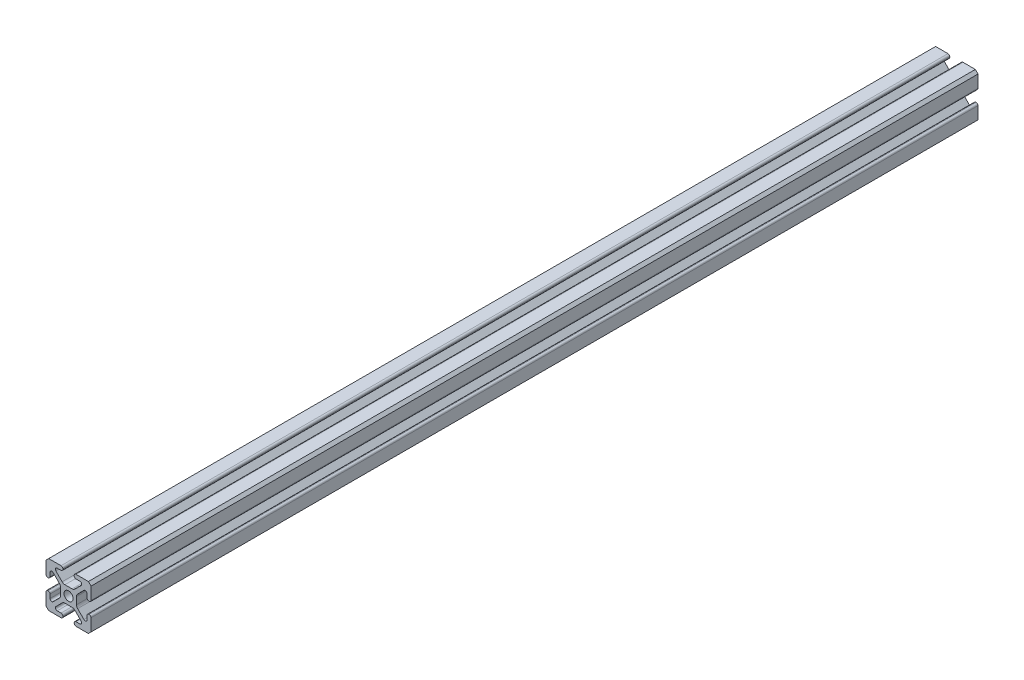
from build123d import *

# Parameters (mm, degrees)
BOSS_EXTRUDE1_DEPTH = 500


with BuildPart() as part:
    # Sketch1 → Boss-Extrude1 (new body)
    with BuildSketch(Plane.XY):
        with BuildLine():
            Line((-11.199951579, -12.7), (-4.222256762, -12.7))
            ThreePointArc((-4.222256762, -12.7), (-3.503836272, -12.40242049), (-3.206256762, -11.684))
            Line((-3.206256762, -11.684), (-3.206256762, -11.440665395))
            ThreePointArc((-3.206256762, -11.440665395), (-3.503836272, -10.722244905), (-4.222256762, -10.424665395))
            Line((-4.222256762, -10.424665395), (-6.40926672, -10.424665395))
            ThreePointArc((-6.40926672, -10.424665395), (-7.347928334, -9.797471742), (-7.127687178, -8.690244874))
            Line((-7.127687178, -8.690244874), (-3.593166694, -5.155724698))
            ThreePointArc((-3.593166694, -5.155724698), (-2.876257435, -4.67670128), (-2.030605322, -4.508490626))
            Line((-2.030605322, -4.508490626), (2.030598864, -4.508490626))
            ThreePointArc((2.030598864, -4.508490626), (2.876251031, -4.676701303), (3.593160319, -5.155724782))
            Line((3.593160319, -5.155724782), (7.127680379, -8.690244912))
            ThreePointArc((7.127680379, -8.690244912), (7.347921489, -9.019859032), (7.425259882, -9.408665395))
            ThreePointArc((7.425259882, -9.408665395), (7.127680372, -10.127085884), (6.409259882, -10.424665395))
            Line((6.409259882, -10.424665395), (4.22225065, -10.424665395))
            ThreePointArc((4.22225065, -10.424665395), (3.50383016, -10.722244905), (3.20625065, -11.440665395))
            Line((3.20625065, -11.440665395), (3.20625065, -11.684))
            ThreePointArc((3.20625065, -11.684), (3.50383016, -12.40242049), (4.22225065, -12.7))
            Line((4.22225065, -12.7), (11.199952422, -12.7))
            Line((11.199952422, -12.7), (12.7, -11.199951732))
            Line((12.7, -11.199951732), (12.7, -4.222256762))
            ThreePointArc((12.7, -4.222256762), (12.40242049, -3.503836272), (11.684, -3.206256762))
            Line((11.684, -3.206256762), (11.440665395, -3.206256762))
            ThreePointArc((11.440665395, -3.206256762), (10.722244905, -3.503836272), (10.424665395, -4.222256762))
            Line((10.424665395, -4.222256762), (10.424665395, -6.40926672))
            ThreePointArc((10.424665395, -6.40926672), (9.797471742, -7.347928334), (8.690244874, -7.127687178))
            Line((8.690244874, -7.127687178), (5.155724698, -3.593166694))
            ThreePointArc((5.155724698, -3.593166694), (4.67670128, -2.876257435), (4.508490626, -2.030605322))
            Line((4.508490626, -2.030605322), (4.508490626, 2.030598864))
            ThreePointArc((4.508490626, 2.030598864), (4.676701303, 2.876251031), (5.155724782, 3.593160319))
            Line((5.155724782, 3.593160319), (8.690244912, 7.127680379))
            ThreePointArc((8.690244912, 7.127680379), (9.019859032, 7.347921489), (9.408665395, 7.425259882))
            ThreePointArc((9.408665395, 7.425259882), (10.127085884, 7.127680372), (10.424665395, 6.409259882))
            Line((10.424665395, 6.409259882), (10.424665395, 4.22225065))
            ThreePointArc((10.424665395, 4.22225065), (10.722244905, 3.50383016), (11.440665395, 3.20625065))
            Line((11.440665395, 3.20625065), (11.684, 3.20625065))
            ThreePointArc((11.684, 3.20625065), (12.40242049, 3.50383016), (12.7, 4.22225065))
            Line((12.7, 4.22225065), (12.7, 11.199954756))
            Line((12.7, 11.199954756), (11.199954423, 12.7))
            Line((11.199954423, 12.7), (4.222256762, 12.7))
            ThreePointArc((4.222256762, 12.7), (3.503836272, 12.40242049), (3.206256762, 11.684))
            Line((3.206256762, 11.684), (3.206256762, 11.440665395))
            ThreePointArc((3.206256762, 11.440665395), (3.503836272, 10.722244905), (4.222256762, 10.424665395))
            Line((4.222256762, 10.424665395), (6.40926672, 10.424665395))
            ThreePointArc((6.40926672, 10.424665395), (7.347928334, 9.797471742), (7.127687178, 8.690244874))
            Line((7.127687178, 8.690244874), (3.593166694, 5.155724698))
            ThreePointArc((3.593166694, 5.155724698), (2.876257435, 4.67670128), (2.030605322, 4.508490626))
            Line((2.030605322, 4.508490626), (-2.030598864, 4.508490626))
            ThreePointArc((-2.030598864, 4.508490626), (-2.876251031, 4.676701303), (-3.593160319, 5.155724782))
            Line((-3.593160319, 5.155724782), (-7.127680379, 8.690244912))
            ThreePointArc((-7.127680379, 8.690244912), (-7.347921489, 9.019859032), (-7.425259882, 9.408665395))
            ThreePointArc((-7.425259882, 9.408665395), (-7.127680372, 10.127085884), (-6.409259882, 10.424665395))
            Line((-6.409259882, 10.424665395), (-4.22225065, 10.424665395))
            ThreePointArc((-4.22225065, 10.424665395), (-3.50383016, 10.722244905), (-3.20625065, 11.440665395))
            Line((-3.20625065, 11.440665395), (-3.20625065, 11.684))
            ThreePointArc((-3.20625065, 11.684), (-3.50383016, 12.40242049), (-4.22225065, 12.7))
            Line((-4.22225065, 12.7), (-11.199951733, 12.7))
            Line((-11.199951733, 12.7), (-12.7, 11.1999514))
            Line((-12.7, 11.1999514), (-12.7, 4.222256762))
            ThreePointArc((-12.7, 4.222256762), (-12.40242049, 3.503836272), (-11.684, 3.206256762))
            Line((-11.684, 3.206256762), (-11.440665395, 3.206256762))
            ThreePointArc((-11.440665395, 3.206256762), (-10.722244905, 3.503836272), (-10.424665395, 4.222256762))
            Line((-10.424665395, 4.222256762), (-10.424665395, 6.40926672))
            ThreePointArc((-10.424665395, 6.40926672), (-9.797471742, 7.347928334), (-8.690244874, 7.127687178))
            Line((-8.690244874, 7.127687178), (-5.155724698, 3.593166694))
            ThreePointArc((-5.155724698, 3.593166694), (-4.67670128, 2.876257435), (-4.508490626, 2.030605322))
            Line((-4.508490626, 2.030605322), (-4.508490626, -2.030598864))
            ThreePointArc((-4.508490626, -2.030598864), (-4.676701303, -2.876251031), (-5.155724782, -3.593160319))
            Line((-5.155724782, -3.593160319), (-8.690244912, -7.127680379))
            ThreePointArc((-8.690244912, -7.127680379), (-9.019859032, -7.347921489), (-9.408665395, -7.425259882))
            ThreePointArc((-9.408665395, -7.425259882), (-10.127085884, -7.127680372), (-10.424665395, -6.409259882))
            Line((-10.424665395, -6.409259882), (-10.424665395, -4.22225065))
            ThreePointArc((-10.424665395, -4.22225065), (-10.722244905, -3.50383016), (-11.440665395, -3.20625065))
            Line((-11.440665395, -3.20625065), (-11.684, -3.20625065))
            ThreePointArc((-11.684, -3.20625065), (-12.40242049, -3.50383016), (-12.7, -4.22225065))
            Line((-12.7, -4.22225065), (-12.7, -11.199952268))
            Line((-12.7, -11.199952268), (-11.199951579, -12.7))
        make_face()
        with BuildLine():
            ThreePointArc((-2.55499489, 0), (0, -2.55499489), (2.55499489, 0))
            ThreePointArc((2.55499489, 0), (0, 2.55499489), (-2.55499489, 0))
        make_face(mode=Mode.SUBTRACT)
    extrude(amount=BOSS_EXTRUDE1_DEPTH)


solid = part.part
